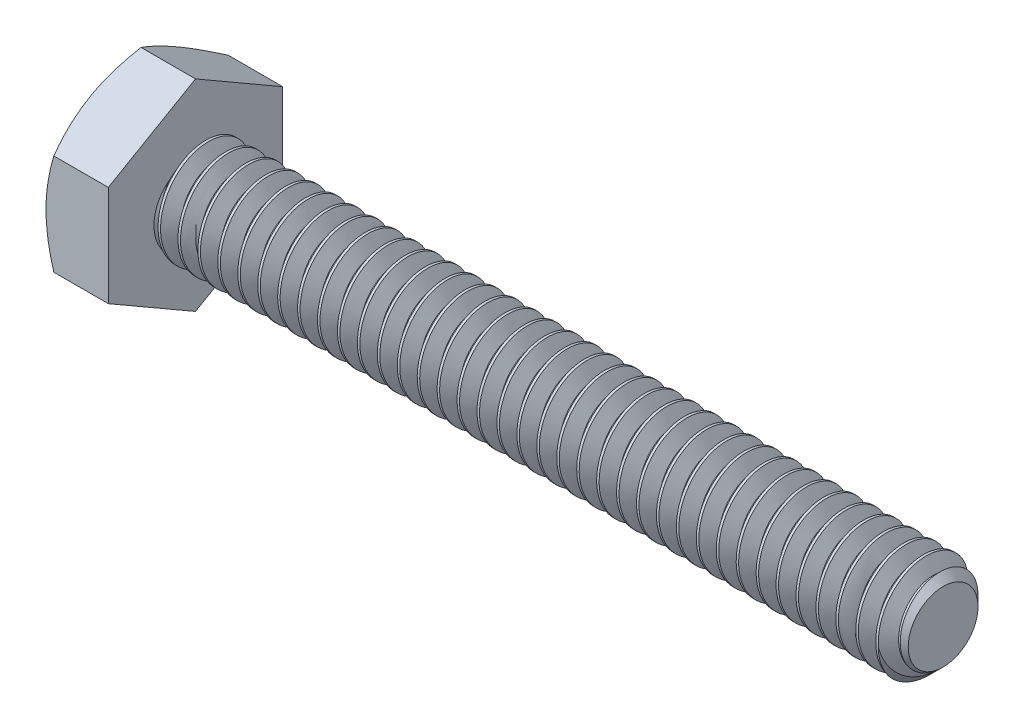
from build123d import *

# Parameters (mm, degrees)
SKETCH5_R           = 3.175
BOSS_EXTRUDE3_DEPTH = 47.625
CHAMFER1_SIZE       = 0.9525
CUT_SWEEP1_PITCH    = 1.27
BOSS_EXTRUDE4_DEPTH = 3.96875
SKETCH8_OUTSIDE_W   = 208.568
SKETCH8_OUTSIDE_H   = 210.288
SKETCH8_OUTSIDE_R   = 5.55625
CUT_EXTRUDE3_DEPTH  = 53.287183113
CUT_EXTRUDE3_DRAFT  = -60


with BuildPart() as part:
    # Sketch5 → Boss-Extrude3 (new body)
    with BuildSketch(Plane(origin=(25.796875, 0, 0), x_dir=(0, 0, -1), z_dir=(1, 0, 0))):
        Circle(SKETCH5_R)
    extrude(amount=-BOSS_EXTRUDE3_DEPTH)

    # Chamfer1
    chamfer1_edges = [part.edges().sort_by_distance(p)[0] for p in [
        (25.796875, 0, 3.175),
    ]]
    chamfer(chamfer1_edges, length=CHAMFER1_SIZE)

    # Cut-Sweep1: arcs per turn and ends read off the stored shape
    # Cut-Sweep1: the profile of Sketch10 profile screwed along a right-hand helix through 38.5 turns, 8 arcs to a turn; built about Z, then put on its axis
    cut_sweep1_z = Axis((0, 0, 0), (0, 0, 1))
    cut_sweep1_corners = [(3.1753, 0, 0.000173205), (2.350110803, 0, -0.47625), (2.350110803, 0, -0.635), (3.1753, 0, -1.111423205)]
    with BuildLine(mode=Mode.PRIVATE) as cut_sweep1_profile:
        Line(cut_sweep1_corners[0], cut_sweep1_corners[1])
        Line(cut_sweep1_corners[1], cut_sweep1_corners[2])
        Line(cut_sweep1_corners[2], cut_sweep1_corners[3])
        Line(cut_sweep1_corners[3], cut_sweep1_corners[0])
    cut_sweep1_cap = Face(cut_sweep1_profile.wire())
    cut_sweep1_turn_angles = [0, 22.5, 45, 67.5, 90, 112.5, 135, 157.5, 180, 202.5, 225, 247.5, 270, 292.5, 315, 337.5, 360]
    cut_sweep1_turn_weights = [1, 0.9238795325112867, 1, 0.9238795325112867, 1, 0.9238795325112867, 1, 0.9238795325112867, 1, 0.9238795325112867, 1, 0.9238795325112867, 1, 0.9238795325112867, 1, 0.9238795325112867, 1]
    cut_sweep1_turn_rails = [Edge.make_bspline([Vector(p[0], p[1], 0).rotate(cut_sweep1_z, cut_sweep1_turn_angles[k]) / cut_sweep1_turn_weights[k] + Vector(0, 0, p[2] + CUT_SWEEP1_PITCH * cut_sweep1_turn_angles[k] / 360) for k in range(17)], [0, 0, 0, 1, 1, 2, 2, 3, 3, 4, 4, 5, 5, 6, 6, 7, 7, 8, 8, 8], 2, cut_sweep1_turn_weights) for p in cut_sweep1_corners]
    cut_sweep1_turn_sides = [Face.make_surface_from_curves(cut_sweep1_turn_rails[p[0]], cut_sweep1_turn_rails[p[1]]) for p in [(0, 1), (1, 2), (2, 3), (3, 0)]]
    cut_sweep1_last_angles = [13680, 13702.5, 13725, 13747.5, 13770, 13792.5, 13815, 13837.5, 13860]
    cut_sweep1_last_weights = [1, 0.9238795325112867, 1, 0.9238795325112867, 1, 0.9238795325112867, 1, 0.9238795325107462, 1]
    cut_sweep1_last_rails = [Edge.make_bspline([Vector(p[0], p[1], 0).rotate(cut_sweep1_z, cut_sweep1_last_angles[k]) / cut_sweep1_last_weights[k] + Vector(0, 0, p[2] + CUT_SWEEP1_PITCH * cut_sweep1_last_angles[k] / 360) for k in range(9)], [0, 0, 0, 1, 1, 2, 2, 3, 3, 4, 4, 4], 2, cut_sweep1_last_weights) for p in cut_sweep1_corners]
    cut_sweep1_last_sides = [Face.make_surface_from_curves(cut_sweep1_last_rails[p[0]], cut_sweep1_last_rails[p[1]]) for p in [(0, 1), (1, 2), (2, 3), (3, 0)]]
    cut_sweep1 = Plane(origin=(25.796875, 0, 0), x_dir=(0, 1, 0), z_dir=(-1, 0, 0)) * Solid(Shell([*[p.moved(Location((0, 0, CUT_SWEEP1_PITCH * i))) for i in range(38) for p in cut_sweep1_turn_sides], *cut_sweep1_last_sides, cut_sweep1_cap, cut_sweep1_cap.rotate(cut_sweep1_z, 13860).moved(Location((0, 0, CUT_SWEEP1_PITCH * 13860 / 360)))]))
    add(cut_sweep1, mode=Mode.SUBTRACT)

    # Sketch6 → Boss-Extrude4 (add)
    with BuildSketch(Plane.ZY.offset(21.828125)):
        Polygon((5.55625, 3.207902433), (0, 6.415804866), (-5.55625, 3.207902433), (-5.55625, -3.207902433), (0, -6.415804866), (5.55625, -3.207902433), align=None)
    extrude(amount=BOSS_EXTRUDE4_DEPTH)


with BuildPart() as cut_extrude3_tool:
    # Sketch8 outside → Cut-Extrude3 (with draft: the straight prism first)
    with BuildSketch(Plane.ZY.offset(25.796875)):
        Rectangle(SKETCH8_OUTSIDE_W, SKETCH8_OUTSIDE_H)
        Circle(SKETCH8_OUTSIDE_R, mode=Mode.SUBTRACT)
    extrude(amount=-CUT_EXTRUDE3_DEPTH)
    # Cut-Extrude3: the draft: its side faces are tilted about the plane it starts from
    cut_extrude3_sides = [cut_extrude3_tool.faces().sort_by_distance(p)[0] for p in [
        (0.846716557, -105.144, 0),
        (0.846716557, 0, 104.284),
        (0.846716557, 105.144, 0),
        (0.846716557, 0, -104.284),
        (0.846716557, 0, -5.55625),
    ]]
    draft(cut_extrude3_sides, Plane.ZY.offset(25.796875), CUT_EXTRUDE3_DRAFT)


with BuildPart() as part_1:
    add(part.part)

    # Cut-Extrude3: cut by cut_extrude3_tool
    add(cut_extrude3_tool.part, mode=Mode.SUBTRACT)


solid = part_1.part
